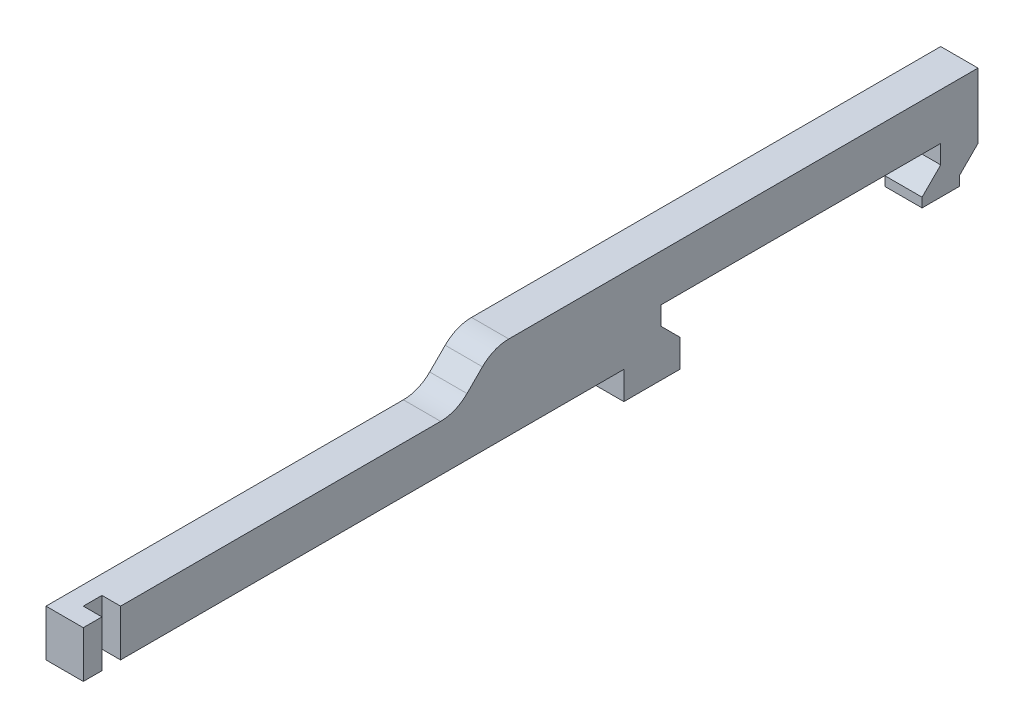
from build123d import *

# Parameters (mm, degrees)
EXTRUDE_1_DEPTH     = 2
FILLET_1_R          = 2
SKETCH_2_W          = 1
SKETCH_2_H          = 1
CUT_EXTRUDE_1_DEPTH = 49.207883173


with BuildPart() as part:
    # Эскиз1 → Бобышка-Вытянуть1 (new body)
    with BuildSketch(Plane(origin=(0, 0, 0), x_dir=(0, 0, -1), z_dir=(1, 0, 0))):
        Polygon((0, 0), (29, 0), (29, -1.5), (32, -1.5), (32, 0), (31, 1), (31, 2), (46, 2), (46, 1), (45, 0), (45, -0.5), (47, -0.5), (47, 0), (48, 1), (48, 4.5), (22, 4.5), (20, 2.5), (0, 2.5), align=None)
    extrude(amount=EXTRUDE_1_DEPTH)

    # Скругление1
    fillet_1_edges = [part.edges().sort_by_distance(p)[0] for p in [
        (1, 4.5, -22),
        (1, 2.5, -20),
    ]]
    fillet(fillet_1_edges, radius=FILLET_1_R)

    # Эскиз2 → Вырез-Вытянуть1 (cut, through all)
    with BuildSketch(Plane(origin=(0, 2.5, 0), x_dir=(1, 0, 0), z_dir=(0, 1, 0))):
        with Locations((1.5, 1.5)):
            Rectangle(SKETCH_2_W, SKETCH_2_H)
    extrude(amount=-CUT_EXTRUDE_1_DEPTH, mode=Mode.SUBTRACT)


solid = part.part
